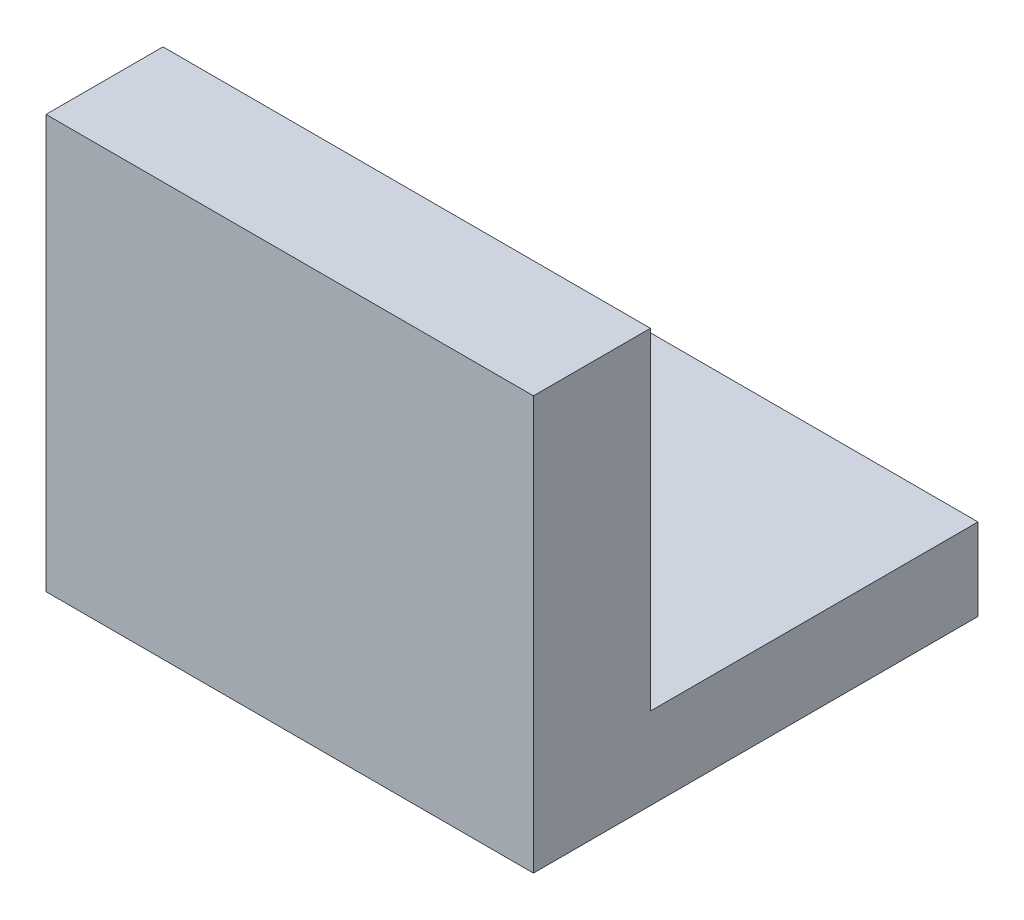
from build123d import *

# Parameters (mm, degrees)
ESQUISSE1_W        = 12.5
ESQUISSE1_H        = 2.1
BOSS_EXTRU_1_DEPTH = 8.4
ESQUISSE2_W        = 12.5
ESQUISSE2_H        = 10.600195181
BOSS_EXTRU_2_DEPTH = 3


with BuildPart() as part:
    # Esquisse1 → Boss.-Extru.1 (new body)
    with BuildSketch(Plane.XY):
        with Locations((6.25, 1.05)):
            Rectangle(ESQUISSE1_W, ESQUISSE1_H)
    extrude(amount=BOSS_EXTRU_1_DEPTH)

    # Esquisse2 → Boss.-Extru.2 (add)
    with BuildSketch(Plane.XY.offset(8.4)):
        with Locations((6.25, 5.300097591)):
            Rectangle(ESQUISSE2_W, ESQUISSE2_H)
    extrude(amount=BOSS_EXTRU_2_DEPTH)


solid = part.part
